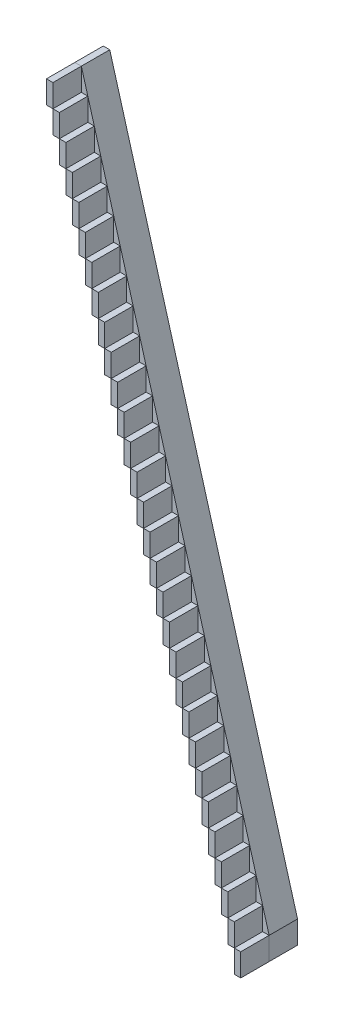
from build123d import *

# Parameters (mm, degrees)
SKETCH2_W              = 1.139995489
SKETCH2_H              = 4
BOSS_EXTRUDE1_DEPTH    = 5
SKETCH2_W_2            = 1.14
BOSS_EXTRUDE1_2_DEPTH  = 5
BOSS_EXTRUDE1_3_DEPTH  = 5
BOSS_EXTRUDE1_4_DEPTH  = 5
BOSS_EXTRUDE1_5_DEPTH  = 5
BOSS_EXTRUDE1_6_DEPTH  = 5
BOSS_EXTRUDE1_7_DEPTH  = 5
BOSS_EXTRUDE1_8_DEPTH  = 5
BOSS_EXTRUDE1_9_DEPTH  = 5
BOSS_EXTRUDE1_10_DEPTH = 5
BOSS_EXTRUDE1_11_DEPTH = 5
BOSS_EXTRUDE1_12_DEPTH = 5
BOSS_EXTRUDE1_13_DEPTH = 5
BOSS_EXTRUDE1_14_DEPTH = 5
BOSS_EXTRUDE1_15_DEPTH = 5
BOSS_EXTRUDE1_16_DEPTH = 5
BOSS_EXTRUDE1_17_DEPTH = 5
BOSS_EXTRUDE1_18_DEPTH = 5
BOSS_EXTRUDE1_19_DEPTH = 5
BOSS_EXTRUDE1_20_DEPTH = 5
BOSS_EXTRUDE1_21_DEPTH = 5
BOSS_EXTRUDE1_22_DEPTH = 5
BOSS_EXTRUDE1_23_DEPTH = 5
BOSS_EXTRUDE1_24_DEPTH = 5
BOSS_EXTRUDE1_25_DEPTH = 5
BOSS_EXTRUDE1_26_DEPTH = 5
BOSS_EXTRUDE1_27_DEPTH = 5
BOSS_EXTRUDE1_28_DEPTH = 5
BOSS_EXTRUDE1_29_DEPTH = 5
BOSS_EXTRUDE1_30_DEPTH = 5
BOSS_EXTRUDE3_DEPTH    = 5


with BuildPart() as part:
    # Sketch2 → Boss-Extrude1 (new body)
    with BuildSketch(Plane.XY):
        with Locations((-1.560223433, 2.169459459)):
            Rectangle(SKETCH2_W, SKETCH2_H)
    extrude(amount=BOSS_EXTRUDE1_DEPTH)


with BuildPart() as body_2:
    # Sketch2 → Boss-Extrude1 2 (new body)
    with BuildSketch(Plane.XY):
        with Locations((-34.620225688, 118.169459459)):
            Rectangle(SKETCH2_W_2, SKETCH2_H)
    extrude(amount=BOSS_EXTRUDE1_2_DEPTH)


with BuildPart() as body_3:
    # Sketch2 → Boss-Extrude1 3 (new body)
    with BuildSketch(Plane.XY):
        with Locations((-33.480225688, 114.169459459)):
            Rectangle(SKETCH2_W_2, SKETCH2_H)
    extrude(amount=BOSS_EXTRUDE1_3_DEPTH)


with BuildPart() as body_4:
    # Sketch2 → Boss-Extrude1 4 (new body)
    with BuildSketch(Plane.XY):
        with Locations((-32.340225688, 110.169459459)):
            Rectangle(SKETCH2_W_2, SKETCH2_H)
    extrude(amount=BOSS_EXTRUDE1_4_DEPTH)


with BuildPart() as body_5:
    # Sketch2 → Boss-Extrude1 5 (new body)
    with BuildSketch(Plane.XY):
        with Locations((-31.200225688, 106.169459459)):
            Rectangle(SKETCH2_W_2, SKETCH2_H)
    extrude(amount=BOSS_EXTRUDE1_5_DEPTH)


with BuildPart() as body_6:
    # Sketch2 → Boss-Extrude1 6 (new body)
    with BuildSketch(Plane.XY):
        with Locations((-30.060225688, 102.169459459)):
            Rectangle(SKETCH2_W_2, SKETCH2_H)
    extrude(amount=BOSS_EXTRUDE1_6_DEPTH)


with BuildPart() as body_7:
    # Sketch2 → Boss-Extrude1 7 (new body)
    with BuildSketch(Plane.XY):
        with Locations((-28.920225688, 98.169459459)):
            Rectangle(SKETCH2_W_2, SKETCH2_H)
    extrude(amount=BOSS_EXTRUDE1_7_DEPTH)


with BuildPart() as body_8:
    # Sketch2 → Boss-Extrude1 8 (new body)
    with BuildSketch(Plane.XY):
        with Locations((-27.780225688, 94.169459459)):
            Rectangle(SKETCH2_W_2, SKETCH2_H)
    extrude(amount=BOSS_EXTRUDE1_8_DEPTH)


with BuildPart() as body_9:
    # Sketch2 → Boss-Extrude1 9 (new body)
    with BuildSketch(Plane.XY):
        with Locations((-26.640225688, 90.169459459)):
            Rectangle(SKETCH2_W_2, SKETCH2_H)
    extrude(amount=BOSS_EXTRUDE1_9_DEPTH)


with BuildPart() as body_10:
    # Sketch2 → Boss-Extrude1 10 (new body)
    with BuildSketch(Plane.XY):
        with Locations((-25.500225688, 86.169459459)):
            Rectangle(SKETCH2_W_2, SKETCH2_H)
    extrude(amount=BOSS_EXTRUDE1_10_DEPTH)


with BuildPart() as body_11:
    # Sketch2 → Boss-Extrude1 11 (new body)
    with BuildSketch(Plane.XY):
        with Locations((-24.360225688, 82.169459459)):
            Rectangle(SKETCH2_W_2, SKETCH2_H)
    extrude(amount=BOSS_EXTRUDE1_11_DEPTH)


with BuildPart() as body_12:
    # Sketch2 → Boss-Extrude1 12 (new body)
    with BuildSketch(Plane.XY):
        with Locations((-23.220225688, 78.169459459)):
            Rectangle(SKETCH2_W_2, SKETCH2_H)
    extrude(amount=BOSS_EXTRUDE1_12_DEPTH)


with BuildPart() as body_13:
    # Sketch2 → Boss-Extrude1 13 (new body)
    with BuildSketch(Plane.XY):
        with Locations((-22.080225688, 74.169459459)):
            Rectangle(SKETCH2_W_2, SKETCH2_H)
    extrude(amount=BOSS_EXTRUDE1_13_DEPTH)


with BuildPart() as body_14:
    # Sketch2 → Boss-Extrude1 14 (new body)
    with BuildSketch(Plane.XY):
        with Locations((-20.940225688, 70.169459459)):
            Rectangle(SKETCH2_W_2, SKETCH2_H)
    extrude(amount=BOSS_EXTRUDE1_14_DEPTH)


with BuildPart() as body_15:
    # Sketch2 → Boss-Extrude1 15 (new body)
    with BuildSketch(Plane.XY):
        with Locations((-19.800225688, 66.169459459)):
            Rectangle(SKETCH2_W_2, SKETCH2_H)
    extrude(amount=BOSS_EXTRUDE1_15_DEPTH)


with BuildPart() as body_16:
    # Sketch2 → Boss-Extrude1 16 (new body)
    with BuildSketch(Plane.XY):
        with Locations((-18.660225688, 62.169459459)):
            Rectangle(SKETCH2_W_2, SKETCH2_H)
    extrude(amount=BOSS_EXTRUDE1_16_DEPTH)


with BuildPart() as body_17:
    # Sketch2 → Boss-Extrude1 17 (new body)
    with BuildSketch(Plane.XY):
        with Locations((-17.520225688, 58.169459459)):
            Rectangle(SKETCH2_W_2, SKETCH2_H)
    extrude(amount=BOSS_EXTRUDE1_17_DEPTH)


with BuildPart() as body_18:
    # Sketch2 → Boss-Extrude1 18 (new body)
    with BuildSketch(Plane.XY):
        with Locations((-16.380225688, 54.169459459)):
            Rectangle(SKETCH2_W_2, SKETCH2_H)
    extrude(amount=BOSS_EXTRUDE1_18_DEPTH)


with BuildPart() as body_19:
    # Sketch2 → Boss-Extrude1 19 (new body)
    with BuildSketch(Plane.XY):
        with Locations((-15.240225688, 50.169459459)):
            Rectangle(SKETCH2_W_2, SKETCH2_H)
    extrude(amount=BOSS_EXTRUDE1_19_DEPTH)


with BuildPart() as body_20:
    # Sketch2 → Boss-Extrude1 20 (new body)
    with BuildSketch(Plane.XY):
        with Locations((-14.100225688, 46.169459459)):
            Rectangle(SKETCH2_W_2, SKETCH2_H)
    extrude(amount=BOSS_EXTRUDE1_20_DEPTH)


with BuildPart() as body_21:
    # Sketch2 → Boss-Extrude1 21 (new body)
    with BuildSketch(Plane.XY):
        with Locations((-12.960225688, 42.169459459)):
            Rectangle(SKETCH2_W_2, SKETCH2_H)
    extrude(amount=BOSS_EXTRUDE1_21_DEPTH)


with BuildPart() as body_22:
    # Sketch2 → Boss-Extrude1 22 (new body)
    with BuildSketch(Plane.XY):
        with Locations((-11.820225688, 38.169459459)):
            Rectangle(SKETCH2_W_2, SKETCH2_H)
    extrude(amount=BOSS_EXTRUDE1_22_DEPTH)


with BuildPart() as body_23:
    # Sketch2 → Boss-Extrude1 23 (new body)
    with BuildSketch(Plane.XY):
        with Locations((-10.680225688, 34.169459459)):
            Rectangle(SKETCH2_W_2, SKETCH2_H)
    extrude(amount=BOSS_EXTRUDE1_23_DEPTH)


with BuildPart() as body_24:
    # Sketch2 → Boss-Extrude1 24 (new body)
    with BuildSketch(Plane.XY):
        with Locations((-9.540225688, 30.169459459)):
            Rectangle(SKETCH2_W_2, SKETCH2_H)
    extrude(amount=BOSS_EXTRUDE1_24_DEPTH)


with BuildPart() as body_25:
    # Sketch2 → Boss-Extrude1 25 (new body)
    with BuildSketch(Plane.XY):
        with Locations((-8.400225688, 26.169459459)):
            Rectangle(SKETCH2_W_2, SKETCH2_H)
    extrude(amount=BOSS_EXTRUDE1_25_DEPTH)


with BuildPart() as body_26:
    # Sketch2 → Boss-Extrude1 26 (new body)
    with BuildSketch(Plane.XY):
        with Locations((-7.260225688, 22.169459459)):
            Rectangle(SKETCH2_W_2, SKETCH2_H)
    extrude(amount=BOSS_EXTRUDE1_26_DEPTH)


with BuildPart() as body_27:
    # Sketch2 → Boss-Extrude1 27 (new body)
    with BuildSketch(Plane.XY):
        with Locations((-6.120225688, 18.169459459)):
            Rectangle(SKETCH2_W_2, SKETCH2_H)
    extrude(amount=BOSS_EXTRUDE1_27_DEPTH)


with BuildPart() as body_28:
    # Sketch2 → Boss-Extrude1 28 (new body)
    with BuildSketch(Plane.XY):
        with Locations((-4.980225688, 14.169459459)):
            Rectangle(SKETCH2_W_2, SKETCH2_H)
    extrude(amount=BOSS_EXTRUDE1_28_DEPTH)


with BuildPart() as body_29:
    # Sketch2 → Boss-Extrude1 29 (new body)
    with BuildSketch(Plane.XY):
        Polygon((-3.270221177, 4.169459459), (-2.130221177, 4.169459459), (-2.130221177, 8.169459459), (-3.270225688, 8.169459459), align=None)
    extrude(amount=BOSS_EXTRUDE1_29_DEPTH)


with BuildPart() as body_30:
    # Sketch2 → Boss-Extrude1 30 (new body)
    with BuildSketch(Plane.XY):
        with Locations((-3.840225688, 10.169459459)):
            Rectangle(SKETCH2_W_2, SKETCH2_H)
    extrude(amount=BOSS_EXTRUDE1_30_DEPTH)


with BuildPart() as body_31:
    # Sketch3 → Boss-Extrude3 (new body)
    with BuildSketch(Plane(origin=(0, 0, 0), x_dir=(-1, 0, 0), z_dir=(0, 0, -1))):
        Polygon((0.990225688, 4.169459459), (34.050225688, 120.169459459), (35.190225688, 120.169459459), (35.190221177, 116.169459459), (2.130225688, 0.169459459), (0.990225688, 0.169459459), align=None)
    extrude(amount=BOSS_EXTRUDE3_DEPTH)


solid = Compound([part.part, body_2.part, body_3.part, body_4.part, body_5.part, body_6.part, body_7.part, body_8.part, body_9.part, body_10.part, body_11.part, body_12.part, body_13.part, body_14.part, body_15.part, body_16.part, body_17.part, body_18.part, body_19.part, body_20.part, body_21.part, body_22.part, body_23.part, body_24.part, body_25.part, body_26.part, body_27.part, body_28.part, body_29.part, body_30.part, body_31.part])
